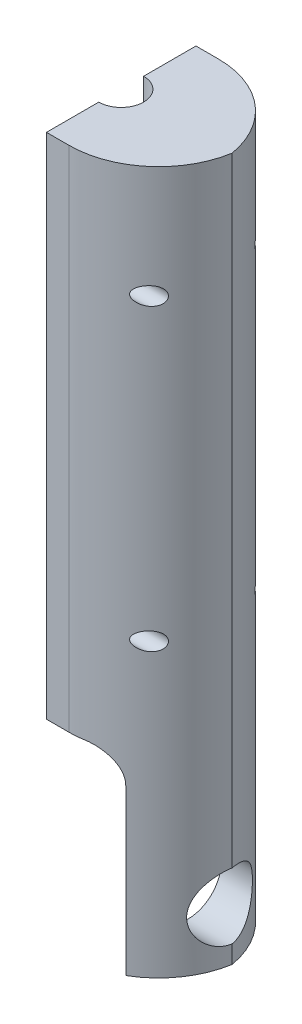
from build123d import *

# Parameters (mm, degrees)
BOSS_EXTRU_1_DEPTH            = 50
CONG_4_R                      = 35
CONG_5_R                      = 35
CONG_6_R                      = 30
CONG_12_R                     = 10
ESQUISSE3_R                   = 11
ENL_V_MAT_EXTRU_4_DEPTH       = 50
ENL_V_MAT_EXTRU_8_DEPTH       = 251
ESQUISSE6_R                   = 2
ENL_V_MAT_EXTRU_9_DEPTH       = 58
ENL_V_MAT_EXTRU_12_DEPTH      = 251.898527225
ENL_V_MAT_EXTRU_12_DEPTH_BACK = 179
ESQUISSE11_R                  = 3
ENL_V_MAT_EXTRU_14_DEPTH      = 20
BOSS_EXTRU_2_DEPTH            = 5


with BuildPart() as part:
    # Esquisse1 → Boss.-Extru.1 (new body)
    with BuildSketch(Plane.XY):
        Polygon((-129.391143911, 131.10701107), (-129.391143911, -98.89298893), (-124.391143911, -98.89298893), (-124.391143911, -33.89298893), (-64.391143911, -33.89298893), (-64.391143911, -98.89298893), (-49.391143911, -98.89298893), (-49.391143911, 131.10701107), align=None)
    extrude(amount=BOSS_EXTRU_1_DEPTH)

    # Congé4
    cong_4_edges = [part.edges().sort_by_distance(p)[0] for p in [
        (-129.391143911, 16.10701107, 50),
    ]]
    fillet(cong_4_edges, radius=CONG_4_R)

    # Congé5
    # the kernel refuses this fillet: 35 mm, written as the material it takes off along each edge
    with BuildSketch(Plane(origin=(-129.391143911, 202.914044152, 0), x_dir=(0, 0, 1), z_dir=(0, -1, 0))) as cong_5_piece_1:
        with BuildLine():
            CenterArc((35, -28.722813233), CONG_5_R, 124.849904579, 55.150095421)
            Line((0, -28.722813233), (-0.7, -28.722813233))
            Line((-0.7, -28.722813233), (-0.7, 0))
            Line((-0.7, 0), (0, 0.7))
            ThreePointArc((0, 0.7), (7.5, 0.7), (14.6, 0.574456265))
            Line((14.6, 0.574456265), (15, 0))
        make_face()
    extrude(amount=373.614066163, mode=Mode.SUBTRACT)

    # Congé6
    # the kernel refuses this fillet: 30 mm, written as the material it takes off along each edge
    with BuildSketch(Plane(origin=(-49.391143911, -173.89298893, 0), x_dir=(-1, 0, 0), z_dir=(0, 1, 0))) as cong_6_piece_1:
        with BuildLine():
            CenterArc((CONG_6_R, CONG_6_R), CONG_6_R, 180, 90)
            Line((0, CONG_6_R), (0, 0))
            Line((0, 0), (CONG_6_R, 0))
        make_face()
    extrude(amount=380, mode=Mode.SUBTRACT)
    with BuildSketch(Plane(origin=(-49.391143911, -173.89298893, 50), x_dir=(-1, 0, 0), z_dir=(0, 1, 0))) as cong_6_piece_2:
        with BuildLine():
            CenterArc((CONG_6_R, -CONG_6_R), CONG_6_R, 90, 90)
            Line((0, -CONG_6_R), (0, 0))
            Line((0, 0), (CONG_6_R, 0))
        make_face()
    extrude(amount=380, mode=Mode.SUBTRACT)

    # Congé12
    cong_12_edges = [part.edges().sort_by_distance(p)[0] for p in [
        (-124.391143911, -33.89298893, 21.146981396),
        (-64.391143911, -33.89298893, 25),
    ]]
    fillet(cong_12_edges, radius=CONG_12_R)

    # Esquisse3 → Enlèv. mat.-Extru.4 (cut)
    with BuildSketch(Plane.ZY.offset(64.391143911)):
        with Locations(Location((25, -81.917553746, 0), (0, 0, 270))):
            Circle(ESQUISSE3_R)
    extrude(amount=-ENL_V_MAT_EXTRU_4_DEPTH, mode=Mode.SUBTRACT)

    # Esquisse5 → Enlèv. mat.-Extru.8 (cut)
    with BuildSketch(Plane(origin=(0, 131.10701107, 0), x_dir=(1, 0, 0), z_dir=(0, 1, 0))):
        with BuildLine():
            Line((-86.891143911, -50), (-86.891143911, 0))
            ThreePointArc((-86.891143911, 0), (-162.141280076, -25), (-86.891143911, -50))
        make_face()
    extrude(amount=-ENL_V_MAT_EXTRU_8_DEPTH, mode=Mode.SUBTRACT)

    # Esquisse6 → Enlèv. mat.-Extru.9 (cut)
    with BuildSketch(Plane.ZY.offset(86.891143911)):
        with Locations((7.5, 98.60701107)):
            Circle(ESQUISSE6_R)
        with Locations((42.5, 98.60701107)):
            Circle(ESQUISSE6_R)
        with Locations((42.5, -1.39298893)):
            Circle(ESQUISSE6_R)
        with Locations((7.5, -1.39298893)):
            Circle(ESQUISSE6_R)
    extrude(amount=-ENL_V_MAT_EXTRU_9_DEPTH, mode=Mode.SUBTRACT)

    # Esquisse9 → Enlèv. mat.-Extru.12 (cut, two sides: drawn at the far end of the back side and taken through both)
    with BuildSketch(Plane(origin=(0, 131.10701107, 0), x_dir=(1, 0, 0), z_dir=(0, 1, 0)).offset(-ENL_V_MAT_EXTRU_12_DEPTH_BACK)):
        with BuildLine():
            Line((-195.505666121, -17.5), (-86.891143911, -17.5))
            ThreePointArc((-86.891143911, -17.5), (-79.391143911, -25), (-86.891143911, -32.5))
            Line((-86.891143911, -32.5), (-195.505666121, -32.5))
            Line((-195.505666121, -32.5), (-412.73471054, -32.5))
            Line((-412.73471054, -32.5), (-412.73471054, -17.5))
            Line((-412.73471054, -17.5), (-195.505666121, -17.5))
        make_face()
    extrude(amount=ENL_V_MAT_EXTRU_12_DEPTH + ENL_V_MAT_EXTRU_12_DEPTH_BACK, mode=Mode.SUBTRACT)

    # Esquisse11 → Enlèv. mat.-Extru.14 (cut)
    with BuildSketch(Plane.ZY.offset(49.810744996)):
        with Locations(Location((42.5, 98.60701107, 0), (0, 0, 180))):
            Circle(ESQUISSE11_R)
        with Locations(Location((7.5, 98.60701107, 0), (0, 0, 180))):
            Circle(ESQUISSE11_R)
        with Locations(Location((42.5, -1.39298893, 0), (0, 0, 180))):
            Circle(ESQUISSE11_R)
        with Locations(Location((7.5, -1.39298893, 0), (0, 0, 180))):
            Circle(ESQUISSE11_R)
    extrude(amount=ENL_V_MAT_EXTRU_14_DEPTH, mode=Mode.SUBTRACT)

    # Esquisse12 → Boss.-Extru.2 (add)
    with BuildSketch(Plane(origin=(0, 131.10701107, 0), x_dir=(1, 0, 0), z_dir=(0, 1, 0))):
        with BuildLine():
            Line((-79.391143911, 0), (-86.891143911, 0))
            Line((-86.891143911, 0), (-86.891143911, -17.5))
            ThreePointArc((-86.891143911, -17.5), (-79.391143911, -25), (-86.891143911, -32.5))
            Line((-86.891143911, -32.5), (-86.891143911, -50))
            Line((-86.891143911, -50), (-79.391143911, -50))
            ThreePointArc((-79.391143911, -50), (-60.02622718, -42.912878475), (-49.810744996, -25))
            ThreePointArc((-49.810744996, -25), (-60.02622718, -7.087121525), (-79.391143911, 0))
        make_face()
    extrude(amount=BOSS_EXTRU_2_DEPTH)


solid = part.part
